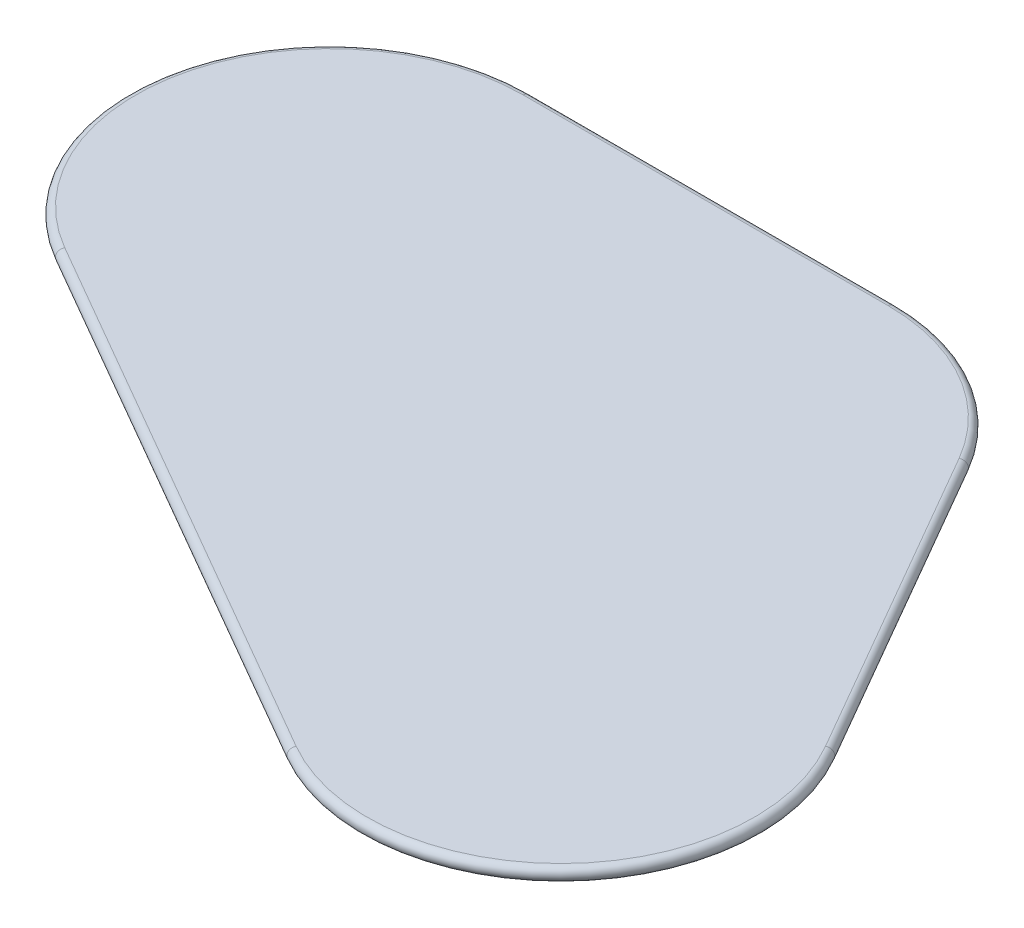
from build123d import *

# Parameters (mm, degrees)
DODANIE_WYCI_GNI_CIE1_DEPTH = 3
ZAOKR_GLENIE1_R             = 1.5


with BuildPart() as part:
    # Szkic1 → Dodanie-wyciągnięcie1 (new body)
    with BuildSketch(Plane(origin=(0, 0, 0), x_dir=(1, 0, 0), z_dir=(0, 1, 0))):
        with BuildLine():
            Line((0, 43.967189626), (-80, 43.967189626))
            ThreePointArc((-80, 43.967189626), (-122.469043969, 11.379546035), (-101.983594813, -38.076703149))
            Line((-101.983594813, -38.076703149), (18.016405187, -107.358735452))
            ThreePointArc((18.016405187, -107.358735452), (71.089497934, -100.371530237), (78.076703149, -47.29843749))
            Line((78.076703149, -47.29843749), (38.076703149, 21.983594813))
            ThreePointArc((38.076703149, 21.983594813), (21.983594813, 38.076703149), (0, 43.967189626))
        make_face()
    extrude(amount=DODANIE_WYCI_GNI_CIE1_DEPTH)

    # Zaokrąglenie1
    zaokr_glenie1_edges = [part.edges().sort_by_distance(p)[0] for p in [
        (-122.469043969, 3, -11.379546035),
        (-41.983594813, 3, 72.717719301),
        (71.089497934, 3, 100.371530237),
        (58.076703149, 3, 12.657421338),
        (21.983594813, 3, -38.076703149),
        (58.076703149, 0, 12.657421338),
        (-41.983594813, 0, 72.717719301),
        (-40, 0, -43.967189626),
        (-40, 3, -43.967189626),
    ]]
    fillet(zaokr_glenie1_edges, radius=ZAOKR_GLENIE1_R - 0.0001)  # a hair under: the kernel refuses the full size


solid = part.part
